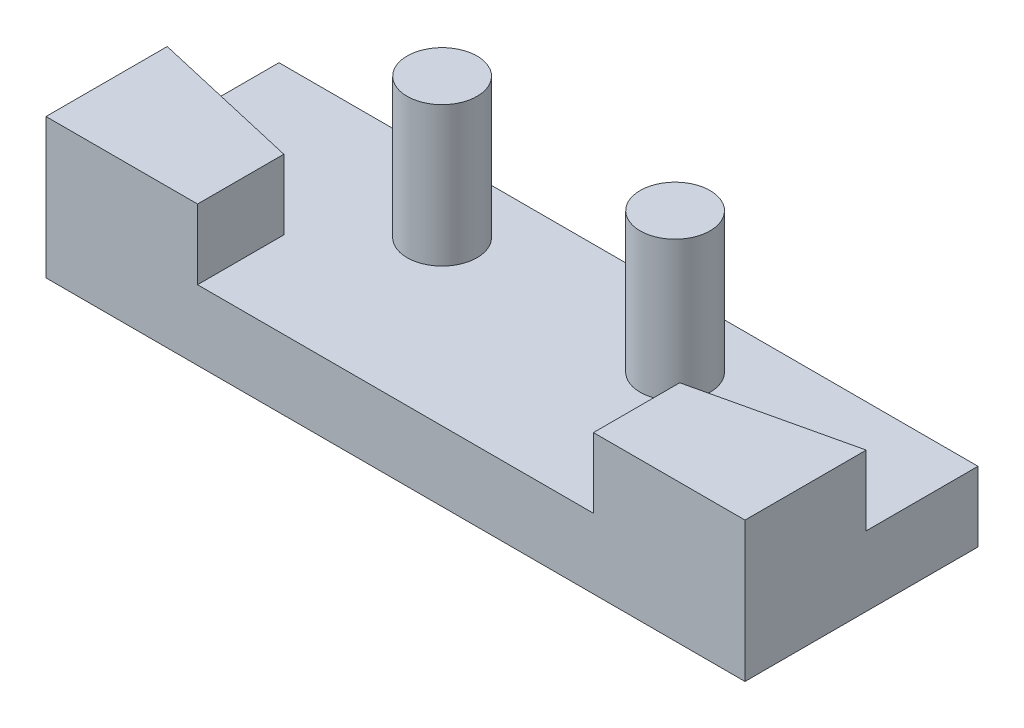
from build123d import *

# Parameters (mm, degrees)
SKETCH2_W             = 30
SKETCH2_H             = 10
BOSS_EXTRUDE2_DEPTH   = 6
CUT_EXTRUDE1_DEPTH    = 3
SKETCH4_4_R           = 1.5
BOSS_EXTRUDE4_DEPTH   = 3
BOSS_EXTRUDE4_2_DEPTH = 3
SKETCH4_5_R           = 1.5
BOSS_EXTRUDE5_DEPTH   = 3


with BuildPart() as part:
    # Sketch2 → Boss-Extrude2 (new body)
    with BuildSketch(Plane(origin=(0, 0, 0), x_dir=(1, 0, 0), z_dir=(0, 1, 0))):
        with Locations((15, -5)):
            Rectangle(SKETCH2_W, SKETCH2_H)
    extrude(amount=BOSS_EXTRUDE2_DEPTH)

    # Sketch4 → Cut-Extrude1 (cut)
    with BuildSketch(Plane(origin=(0, 6, 0), x_dir=(1, 0, 0), z_dir=(0, 1, 0))):
        Polygon((0, -4.79653452), (6.504275855, -6.298164921), (6.504275855, -10), (23.495724145, -10), (23.495724145, -6.298164921), (30, -4.79653452), (30, 0), (0, 0), align=None)
    extrude(amount=-CUT_EXTRUDE1_DEPTH, mode=Mode.SUBTRACT)



with BuildPart() as body_2:
    # Sketch4<4> → Boss-Extrude4 (new body)
    with BuildSketch(Plane(origin=(0, 6, 0), x_dir=(1, 0, 0), z_dir=(0, 1, 0))):
        with Locations((10, -3)):
            Circle(SKETCH4_4_R)
    extrude(amount=BOSS_EXTRUDE4_DEPTH)


with BuildPart() as body_3:
    # Sketch4<4> → Boss-Extrude4 2 (new body)
    with BuildSketch(Plane(origin=(0, 6, 0), x_dir=(1, 0, 0), z_dir=(0, 1, 0))):
        with Locations((20, -3)):
            Circle(SKETCH4_4_R)
    extrude(amount=BOSS_EXTRUDE4_2_DEPTH)


with BuildPart() as part_1:
    add(part.part)

    add(body_2.part)  # Boss-Extrude5 merges body 2

    add(body_3.part)  # Boss-Extrude5 merges body 3
    # Sketch4<5> → Boss-Extrude5 (add)
    with BuildSketch(Plane(origin=(0, 6, 0), x_dir=(1, 0, 0), z_dir=(0, 1, 0))):
        with Locations((10, -3)):
            Circle(SKETCH4_5_R)
        with Locations((20, -3)):
            Circle(SKETCH4_5_R)
    extrude(amount=-BOSS_EXTRUDE5_DEPTH)


solid = part_1.part
